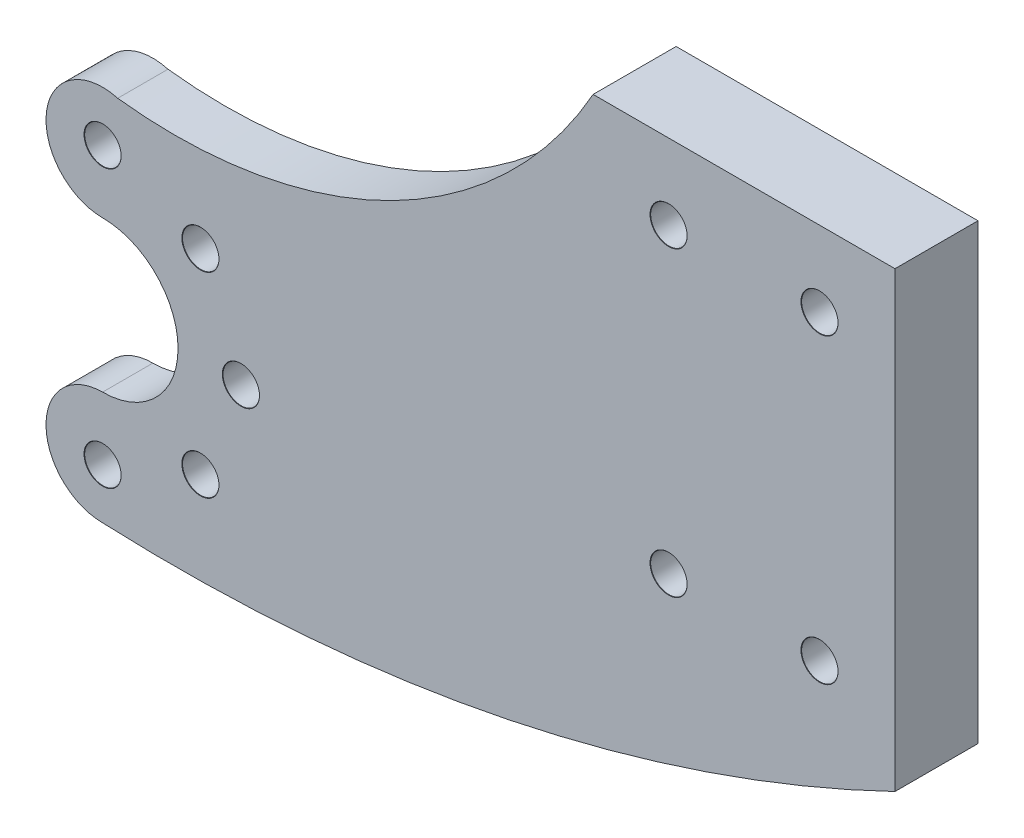
from build123d import *

# Parameters (mm, degrees)
SKETCH_1_W                     = 24
SKETCH_1_H                     = 36
EXTRUDE_1_DEPTH                = 2.6
EXTRUDE_2_DEPTH                = 4
HOLE_WIZARD_M2_5_2_D           = 2.9
HOLE_WIZARD_M2_5_2_CSINK_D     = 2.95
HOLE_WIZARD_M2_5_2_CSINK_ANGLE = 90
HOLE_WIZARD_M2_5_1_D           = 2.9
HOLE_WIZARD_M2_5_1_CSINK_D     = 2.95
HOLE_WIZARD_M2_5_1_CSINK_ANGLE = 90


with BuildPart() as part:
    # 草图1 → 凸台-拉伸1 (new body)
    with BuildSketch(Plane.XY):
        with Locations((-12, 18)):
            Rectangle(SKETCH_1_W, SKETCH_1_H)
    extrude(amount=EXTRUDE_1_DEPTH)

    # 草图4 → 凸台-拉伸2 (add)
    with BuildSketch(Plane.XY.offset(2.6)):
        with BuildLine():
            Line((-63, 8.00100493), (-63, 8))
            ThreePointArc((-63, 8), (-57, 2), (-63, -4))
            Line((-63, -4), (-63, -4.00100493))
            ThreePointArc((-63, -4.00100493), (-67.49899507, -8.5), (-63, -12.99899507))
            ThreePointArc((-63, -12.99899507), (-30.69264412, -10.412370813), (0, 0))
            Line((0, 0), (0, 36))
            Line((0, 36), (-24, 36))
            ThreePointArc((-24, 36), (-39.993336466, 20.688173979), (-61.796842954, 16.835132035))
            ThreePointArc((-61.796842954, 16.835132035), (-67.457841086, 13.107132187), (-63, 8.00100493))
        make_face()
    extrude(amount=EXTRUDE_2_DEPTH)

    # M2.5 间隙孔2 (through all)
    with Locations(Plane.XY.offset(6.6)):
        with Locations((-63, -9), (-63, 13), (-55.221825407, 9.778174593), (-52, 2), (-55.221825407, -5.778174593)):
            CounterSinkHole(HOLE_WIZARD_M2_5_2_D / 2, HOLE_WIZARD_M2_5_2_CSINK_D / 2, counter_sink_angle=HOLE_WIZARD_M2_5_2_CSINK_ANGLE)

    # M2.5 间隙孔1 (through all)
    with Locations(Plane.XY.offset(6.6)):
        with Locations((-6, 30), (-18, 30), (-18, 6), (-6, 6)):
            CounterSinkHole(HOLE_WIZARD_M2_5_1_D / 2, HOLE_WIZARD_M2_5_1_CSINK_D / 2, counter_sink_angle=HOLE_WIZARD_M2_5_1_CSINK_ANGLE)


solid = part.part
